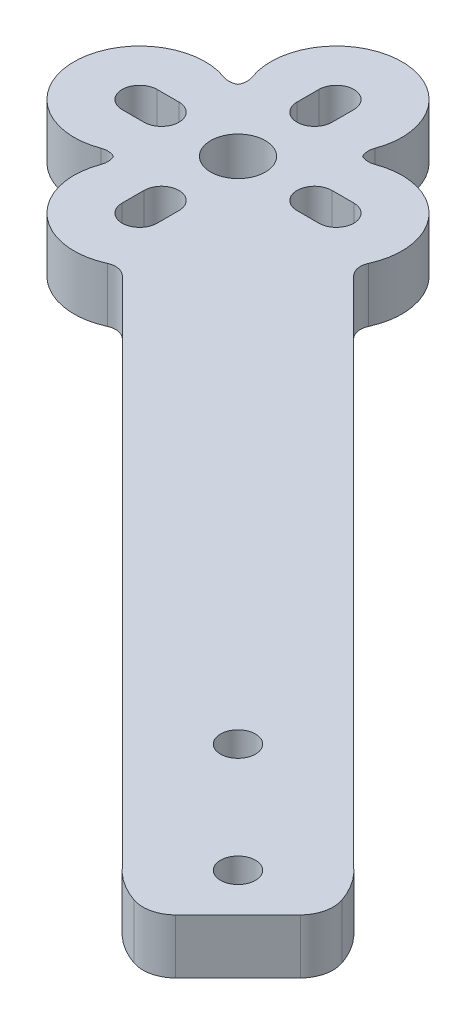
from build123d import *

# Parameters (mm, degrees)
SKETCH1_R           = 1.6
SKETCH1_R_2         = 2.5
BOSS_EXTRUDE1_DEPTH = 5
FILLET1_R           = 1.5
CUT_EXTRUDE1_START  = -10
CUT_EXTRUDE1_DEPTH  = 10
FILLET2_R           = 3
BOSS_EXTRUDE2_DEPTH = 5
CHAMFER1_SIZE2      = 8.660254038
CHAMFER1_SIZE       = 5
CHAMFER2_SIZE2      = 5
CHAMFER2_SIZE       = 8.660254038


# Some blends are built 0.0001 mm under size
with BuildPart() as part:
    # Sketch1 → Boss-Extrude1 (new body)
    with BuildSketch(Plane(origin=(0, 0, 0), x_dir=(1, 0, 0), z_dir=(0, 1, 0))):
        with BuildLine():
            ThreePointArc((-85.12409805, 73.840708631), (-84.725396744, 73.411688245), (-84.296376359, 73.012986939))
            ThreePointArc((-84.296376359, 73.012986939), (-83.127079594, 65.649461526), (-75.690864757, 65.109581606))
            Line((-75.690864757, 65.109581606), (-28.156854249, 17.575571099))
            ThreePointArc((-28.156854249, 17.575571099), (-17.196699141, 17.196699141), (-17.575571099, 28.156854249))
            Line((-17.575571099, 28.156854249), (-65.109581606, 75.690864757))
            ThreePointArc((-65.109581606, 75.690864757), (-65.649461526, 83.127079594), (-73.012986939, 84.296376359))
            ThreePointArc((-73.012986939, 84.296376359), (-73.411688245, 84.725396744), (-73.840708631, 85.12409805))
            ThreePointArc((-73.840708631, 85.12409805), (-79.068542495, 94.068542495), (-84.296376359, 85.12409805))
            ThreePointArc((-84.296376359, 85.12409805), (-84.725396744, 84.725396744), (-85.12409805, 84.296376359))
            ThreePointArc((-85.12409805, 84.296376359), (-94.068542495, 79.068542495), (-85.12409805, 73.840708631))
        make_face()
        with BuildLine():
            Line((-80.668542495, 86.068542495), (-80.668542495, 88.068542495))
            ThreePointArc((-80.668542495, 88.068542495), (-79.068542495, 89.668542495), (-77.468542495, 88.068542495))
            Line((-77.468542495, 88.068542495), (-77.468542495, 86.068542495))
            ThreePointArc((-77.468542495, 86.068542495), (-79.068542495, 84.468542495), (-80.668542495, 86.068542495))
        make_face(mode=Mode.SUBTRACT)
        with Locations(Location((-22.5, 22.5, 0), (0, 0, 270))):
            Circle(SKETCH1_R, mode=Mode.SUBTRACT)
        with Locations(Location((-32.5, 32.5, 0), (0, 0, 270))):
            Circle(SKETCH1_R, mode=Mode.SUBTRACT)
        with BuildLine():
            Line((-80.668542495, 70.068542495), (-80.668542495, 72.068542495))
            ThreePointArc((-80.668542495, 72.068542495), (-79.068542495, 73.668542495), (-77.468542495, 72.068542495))
            Line((-77.468542495, 72.068542495), (-77.468542495, 70.068542495))
            ThreePointArc((-77.468542495, 70.068542495), (-79.068542495, 68.468542495), (-80.668542495, 70.068542495))
        make_face(mode=Mode.SUBTRACT)
        with BuildLine():
            Line((-86.068542495, 77.468542495), (-88.068542495, 77.468542495))
            ThreePointArc((-88.068542495, 77.468542495), (-89.668542495, 79.068542495), (-88.068542495, 80.668542495))
            Line((-88.068542495, 80.668542495), (-86.068542495, 80.668542495))
            ThreePointArc((-86.068542495, 80.668542495), (-84.468542495, 79.068542495), (-86.068542495, 77.468542495))
        make_face(mode=Mode.SUBTRACT)
        with Locations(Location((-79.068542495, 79.068542495, 0), (0, 0, 270))):
            Circle(SKETCH1_R_2, mode=Mode.SUBTRACT)
        with BuildLine():
            ThreePointArc((-70.068542495, 80.668542495), (-68.468542495, 79.068542495), (-70.068542495, 77.468542495))
            Line((-70.068542495, 77.468542495), (-72.068542495, 77.468542495))
            ThreePointArc((-72.068542495, 77.468542495), (-73.668542495, 79.068542495), (-72.068542495, 80.668542495))
            Line((-72.068542495, 80.668542495), (-70.068542495, 80.668542495))
        make_face(mode=Mode.SUBTRACT)
    extrude(amount=BOSS_EXTRUDE1_DEPTH)

    # Fillet1
    # the kernel refuses this fillet: 1.5 mm, written as the material it adds along each edge
    with BuildSketch(Plane(origin=(-75.690864757, 0, -65.109581606), x_dir=(-0.8710919006324759, 0, 0.4911200470887958), z_dir=(0, 1, 0))) as fillet1_piece_1:
        with BuildLine():
            CenterArc((1.140350885, 1.494638979), FILLET1_R, 195.585774364, 69.56865207)
            Line((-0.304493073, 1.091617967), (0, 0))
            ThreePointArc((0, 0), (0.506822616, 0.021444084), (1.013645231, 0))
        make_face()
    extrude(amount=5)
    with BuildSketch(Plane(origin=(-65.109581606, 0, -75.690864757), x_dir=(0.70710678118656, 0, 0.7071067811865349), z_dir=(0, 1, 0))) as fillet1_piece_2:
        with BuildLine():
            CenterArc((1.133289821, 1.5), FILLET1_R, 200.43134793, 69.56865207)
            ThreePointArc((-0.272346884, 0.976372792), (-0.115517872, 0.493948007), (0, 0))
            Line((0, 0), (1.133289821, 0))
        make_face()
    extrude(amount=5)
    with BuildSketch(Plane(origin=(-84.296376359, 0, -85.12409805), x_dir=(-0.7160400781456726, 0, 0.6980591711947771), z_dir=(0, 1, 0))) as fillet1_piece_3:
        with BuildLine():
            CenterArc((1.058307083, -1.497254596), FILLET1_R, 93.467060005, 62.635531643)
            ThreePointArc((-0.313101337, -0.889604248), (-0.139044818, -0.450963409), (0, 0))
            ThreePointArc((0, 0), (0.483797523, -0.014642152), (0.967595047, 0))
        make_face()
    extrude(amount=5)
    with BuildSketch(Plane(origin=(-73.840708631, 0, -85.12409805), x_dir=(0.7160400781456655, 0, 0.6980591711947844), z_dir=(0, 1, 0)), Plane(origin=(-85.12409805, 0, -84.296376359), x_dir=(0.698059171194804, 0, -0.7160400781456464), z_dir=(0, 1, 0)), Plane(origin=(-84.296376359, 0, -73.012986939), x_dir=(-0.716040078145762, 0, -0.6980591711946854), z_dir=(0, 1, 0))) as fillet1_piece_4:
        with BuildLine():
            CenterArc((1.058307083, 1.497254596), FILLET1_R, 203.897408353, 62.635531643)
            ThreePointArc((-0.313101337, 0.889604248), (-0.139044818, 0.450963409), (0, 0))
            ThreePointArc((0, 0), (0.483797523, 0.014642152), (0.967595047, 0))
        make_face()
    extrude(amount=5)
    with BuildSketch(Plane(origin=(-73.012986939, 0, -84.296376359), x_dir=(0.9071785576189849, 0, -0.42074584323120545), z_dir=(0, 1, 0)), Plane(origin=(-85.12409805, 0, -73.840708631), x_dir=(-0.9071785576191526, 0, 0.4207458432308441), z_dir=(0, 1, 0))) as fillet1_piece_5:
        with BuildLine():
            CenterArc((1.060981867, 1.495360386), FILLET1_R, 202.856873055, 62.635531643)
            ThreePointArc((-0.321235194, 0.912714701), (-0.146805923, 0.461218449), (0, 0))
            ThreePointArc((0, 0), (0.471547497, 0.018558455), (0.943094993, 0))
        make_face()
    extrude(amount=5)

    # Sketch4 → Cut-Extrude1 (cut)
    with BuildSketch(Plane(origin=(0, 5, 0), x_dir=(1, 0, 0), z_dir=(0, 1, 0)).offset(CUT_EXTRUDE1_START)):
        with BuildLine():
            Line((-15.011619019, 22.917313169), (-18.964466094, 18.964466094))
            Line((-18.964466094, 18.964466094), (-17.196699141, 17.196699141))
            ThreePointArc((-17.196699141, 17.196699141), (-15.493707308, 19.823834327), (-15.011619019, 22.917313169))
        make_face()
        with BuildLine():
            Line((-17.196699141, 17.196699141), (-18.964466094, 18.964466094))
            Line((-18.964466094, 18.964466094), (-22.917313169, 15.011619019))
            ThreePointArc((-22.917313169, 15.011619019), (-19.823834327, 15.493707308), (-17.196699141, 17.196699141))
        make_face()
    extrude(amount=CUT_EXTRUDE1_DEPTH, mode=Mode.SUBTRACT)

    # Fillet2
    fillet2_edges = [part.edges().sort_by_distance(p)[0] for p in [
        (-22.917313169, 2.5, -15.011619019),
        (-15.011619019, 2.5, -22.917313169),
    ]]
    fillet(fillet2_edges, radius=FILLET2_R)

    # Sketch5 → Boss-Extrude2 (add)
    with BuildSketch(Plane.XZ):
        Polygon((-70.70206426, -64.910255721), (-67.806159991, -67.806159991), (-39.521888743, -39.521888743), (-42.417793012, -36.625984474), align=None)
        Polygon((-39.521888743, -39.521888743), (-67.806159991, -67.806159991), (-65.04521001, -70.567109971), (-36.760938763, -42.282838723), align=None)
    extrude(amount=BOSS_EXTRUDE2_DEPTH)

    # Chamfer1
    chamfer1_edges = [part.edges().sort_by_distance(p)[0] for p in [
        (-67.873637135, -5, -67.738682846),
    ]]
    chamfer1_side = [part.faces().sort_by_distance(p)[0] for p in [
        (-67.873637135, -4.9, -67.738682846),
    ]]
    chamfer(chamfer1_edges, length=CHAMFER1_SIZE - 0.0001, length2=CHAMFER1_SIZE2 - 0.0001, reference=chamfer1_side[0])  # a hair under: the kernel refuses the full size

    # Chamfer2
    chamfer2_edges = [part.edges().sort_by_distance(p)[0] for p in [
        (-39.589365887, -5, -39.454411599),
    ]]
    chamfer2_side = [part.faces().sort_by_distance(p)[0] for p in [
        (-39.660076566, -5, -39.525122277),
    ]]
    chamfer(chamfer2_edges, length=CHAMFER2_SIZE - 0.0001, length2=CHAMFER2_SIZE2 - 0.0001, reference=chamfer2_side[0])  # a hair under: the kernel refuses the full size


solid = part.part
